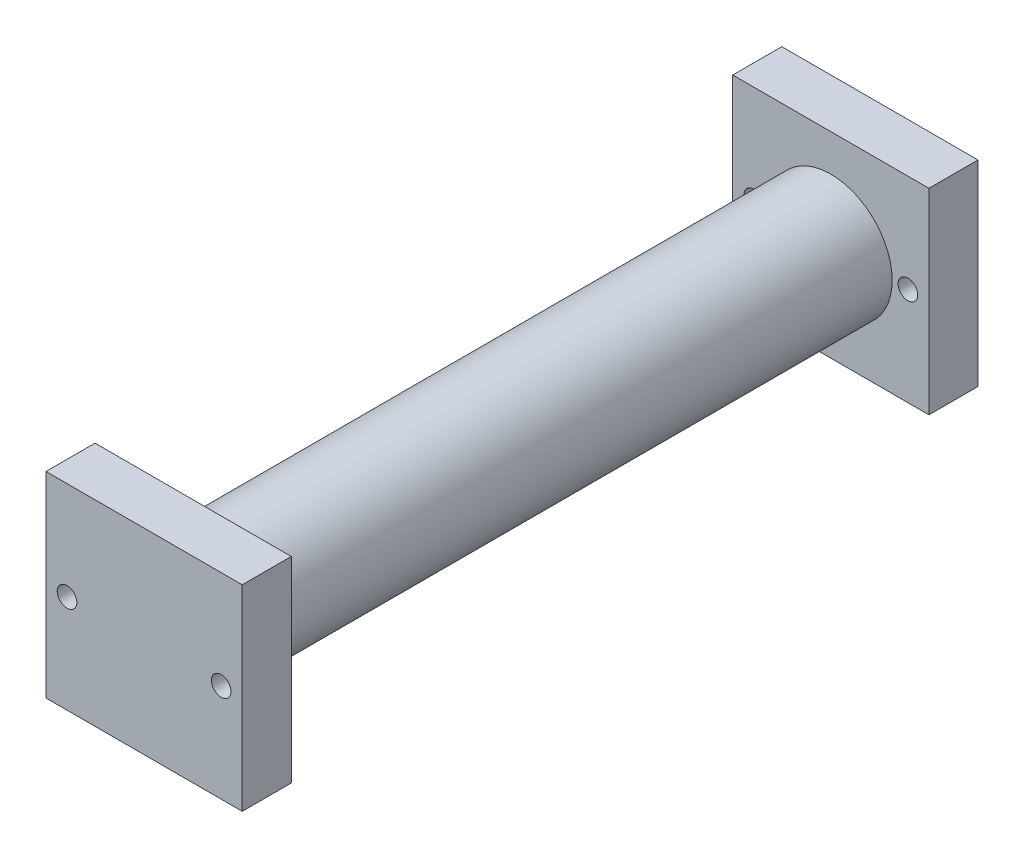
from build123d import *

# Parameters (mm, degrees)
SKETCH_1_W          = 40
SKETCH_1_H          = 40
EXTRUDE_1_DEPTH     = 10
SKETCH_2_R          = 12.5
EXTRUDE_2_DEPTH     = 130
SKETCH_3_W          = 40
SKETCH_3_H          = 40
EXTRUDE_3_DEPTH     = 10
SKETCH_4_R          = 2
CUT_EXTRUDE_1_DEPTH = 10
CUT_EXTRUDE_2_DEPTH = 10
CUT_EXTRUDE_START   = -10
SKETCH_6_R          = 2
CUT_EXTRUDE_3_DEPTH = 10
CUT_EXTRUDE_4_DEPTH = 10


with BuildPart() as part:
    # 草圖1 → 填料-伸長1 (new body)
    with BuildSketch(Plane.XY):
        Rectangle(SKETCH_1_W, SKETCH_1_H)
    extrude(amount=EXTRUDE_1_DEPTH)

    # 草圖2 → 填料-伸長2 (add)
    with BuildSketch(Plane.XY.offset(10)):
        Circle(SKETCH_2_R)
    extrude(amount=EXTRUDE_2_DEPTH)

    # 草圖3 → 填料-伸長3 (add)
    with BuildSketch(Plane.XY.offset(140)):
        Rectangle(SKETCH_3_W, SKETCH_3_H)
    extrude(amount=EXTRUDE_3_DEPTH)

    # 草圖4 → 除料-伸長1 (cut)
    with BuildSketch(Plane.XY.offset(150)):
        with Locations((-15.713957528, 0)):
            Circle(SKETCH_4_R)
    extrude(amount=-CUT_EXTRUDE_1_DEPTH, mode=Mode.SUBTRACT)

    # 草圖5 → 除料-伸長2 (cut)
    with BuildSketch(Plane.XY.offset(150)):
        with BuildLine():
            ThreePointArc((13.71, 0), (15.71, -2), (17.71, 0))
            ThreePointArc((17.71, 0), (15.71, 2), (13.71, 0))
        make_face()
    extrude(amount=-CUT_EXTRUDE_2_DEPTH, mode=Mode.SUBTRACT)

    # 草圖6 → 除料-伸長3 (cut)
    with BuildSketch(Plane(origin=(0, 0, 0), x_dir=(-1, 0, 0), z_dir=(0, 0, -1)).offset(CUT_EXTRUDE_START)):
        with Locations((-15.71, 0)):
            Circle(SKETCH_6_R)
    extrude(amount=CUT_EXTRUDE_3_DEPTH, mode=Mode.SUBTRACT)

    # 草圖7 → 除料-伸長4 (cut)
    with BuildSketch(Plane(origin=(0, 0, 0), x_dir=(-1, 0, 0), z_dir=(0, 0, -1))):
        with BuildLine():
            ThreePointArc((13.71, 0), (15.71, -2), (17.71, 0))
            ThreePointArc((17.71, 0), (15.71, 2), (13.71, 0))
        make_face()
    extrude(amount=-CUT_EXTRUDE_4_DEPTH, mode=Mode.SUBTRACT)


solid = part.part
